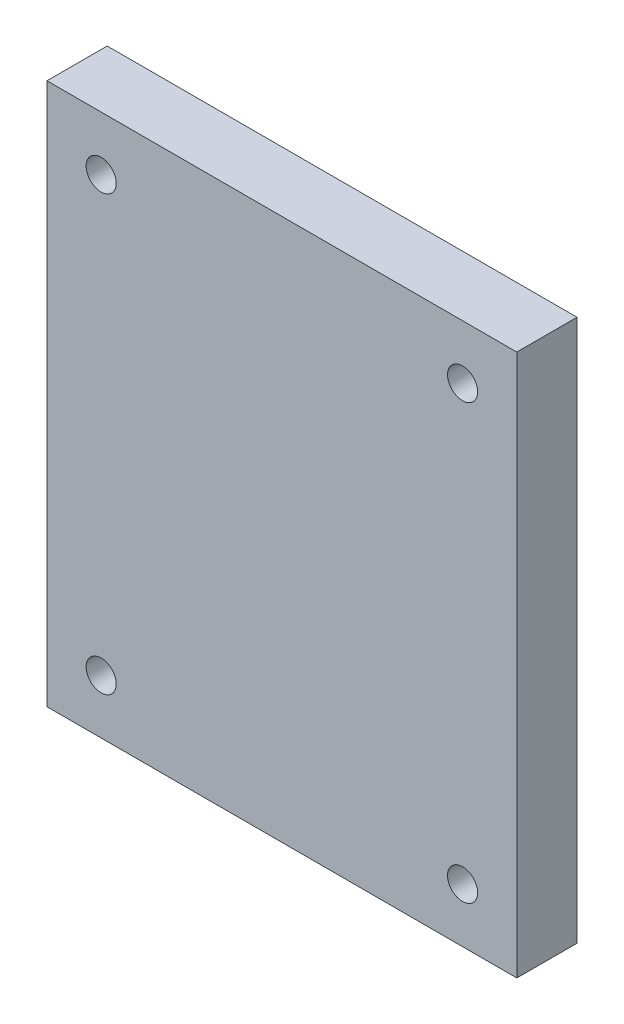
from build123d import *

# Parameters (mm, degrees)
SKETCH1_W           = 39
SKETCH1_H           = 45
SKETCH1_R           = 1.25
BOSS_EXTRUDE1_DEPTH = 5


with BuildPart() as part:
    # Sketch1 → Boss-Extrude1 (new body)
    with BuildSketch(Plane.XY):
        Rectangle(SKETCH1_W, SKETCH1_H)
        with Locations((-15, 18)):
            Circle(SKETCH1_R, mode=Mode.SUBTRACT)
        with Locations((15, 18)):
            Circle(SKETCH1_R, mode=Mode.SUBTRACT)
        with Locations((15, -18)):
            Circle(SKETCH1_R, mode=Mode.SUBTRACT)
        with Locations((-15, -18)):
            Circle(SKETCH1_R, mode=Mode.SUBTRACT)
    extrude(amount=BOSS_EXTRUDE1_DEPTH)


solid = part.part
